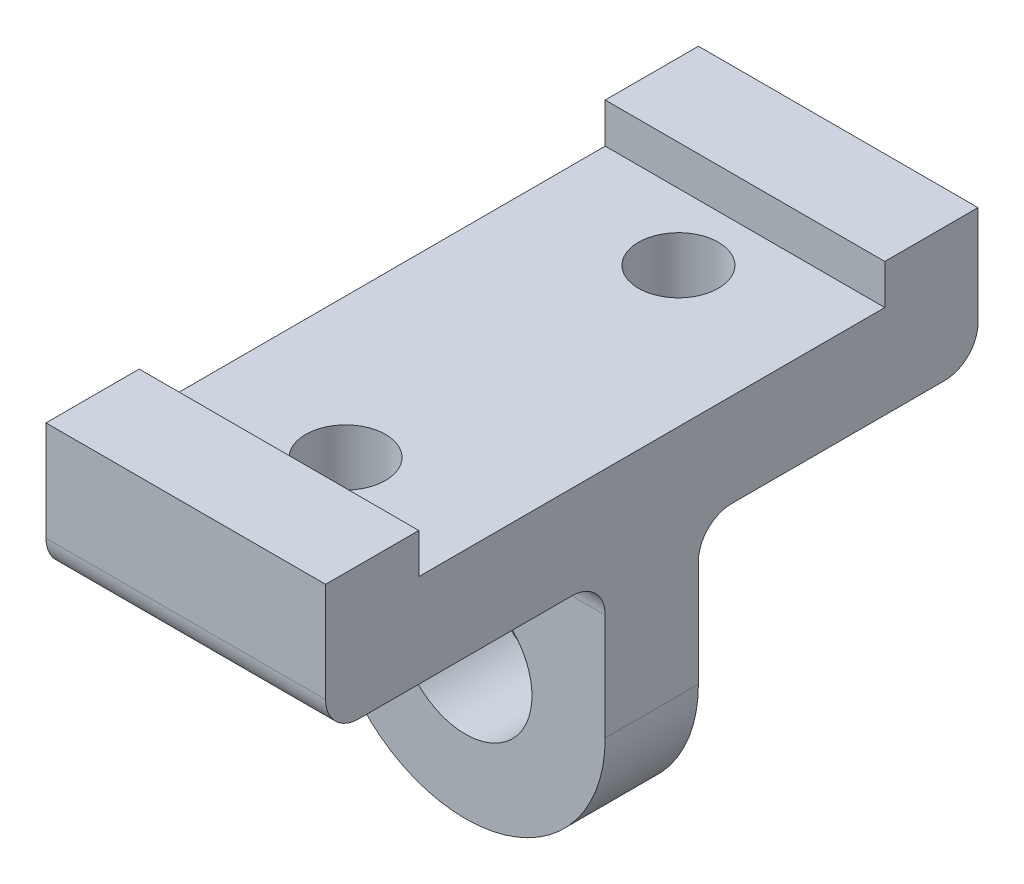
from build123d import *

# Parameters (mm, degrees)
SKETCH1_W               = 42
SKETCH1_H               = 98
BOSS_EXTRUDE1_DEPTH     = 20
SKETCH2_W               = 42
SKETCH2_H               = 70
CUT_EXTRUDE1_DEPTH      = 6
SKETCH3_W               = 42
SKETCH3_H               = 14
BOSS_EXTRUDE2_DEPTH     = 42
FILLET1_R               = 21
CUT_EXTRUDE2_DEPTH      = 74.082145562
CUT_EXTRUDE2_DEPTH_BACK = 74.082145562
SKETCH4_R               = 10
SKETCH6_R               = 6
CUT_EXTRUDE3_DEPTH      = 42
FILLET2_R               = 5


with BuildPart() as part:
    # Sketch1 → Boss-Extrude1 (new body)
    with BuildSketch(Plane(origin=(0, 0, 0), x_dir=(1, 0, 0), z_dir=(0, 1, 0))):
        Rectangle(SKETCH1_W, SKETCH1_H)
    extrude(amount=BOSS_EXTRUDE1_DEPTH)

    # Sketch2 → Cut-Extrude1 (cut)
    with BuildSketch(Plane(origin=(0, 20, 0), x_dir=(1, 0, 0), z_dir=(0, 1, 0))):
        Rectangle(SKETCH2_W, SKETCH2_H)
    extrude(amount=-CUT_EXTRUDE1_DEPTH, mode=Mode.SUBTRACT)

    # Sketch3 → Boss-Extrude2 (add)
    with BuildSketch(Plane.XZ):
        Rectangle(SKETCH3_W, SKETCH3_H)
    extrude(amount=BOSS_EXTRUDE2_DEPTH)

    # Fillet1
    fillet1_edges = [part.edges().sort_by_distance(p)[0] for p in [
        (21, -42, 0),
        (-21, -42, 0),
    ]]
    fillet(fillet1_edges, radius=FILLET1_R - 0.0001)  # a hair under: the kernel refuses the full size

    # Sketch4 → Cut-Extrude2 (cut, two sides: drawn at the far end of the back side and taken through both)
    with BuildSketch(Plane(origin=(0, 0, -7), x_dir=(-1, 0, 0), z_dir=(0, 0, -1)).offset(-CUT_EXTRUDE2_DEPTH_BACK)):
        with Locations((0, -21)):
            Circle(SKETCH4_R)
    extrude(amount=CUT_EXTRUDE2_DEPTH + CUT_EXTRUDE2_DEPTH_BACK, mode=Mode.SUBTRACT)

    # Sketch6 → Cut-Extrude3 (cut)
    with BuildSketch(Plane(origin=(0, 0, 0), x_dir=(1, 0, 0), z_dir=(0, 1, 0))):
        with Locations(Location((0, 25, 0), (0, 0, 90))):
            Circle(SKETCH6_R)
    cut_extrude3 = extrude(amount=CUT_EXTRUDE3_DEPTH, mode=Mode.SUBTRACT)

    # Mirror1: Cut-Extrude3 across plane
    add(cut_extrude3.mirror(Plane.XY), mode=Mode.SUBTRACT)

    # Fillet2
    fillet2_edges = [part.edges().sort_by_distance(p)[0] for p in [
        (0, 0, -7),
        (0, 0, 7),
        (0, 0, -49),
        (0, 0, 49),
    ]]
    fillet(fillet2_edges, radius=FILLET2_R)


solid = part.part
